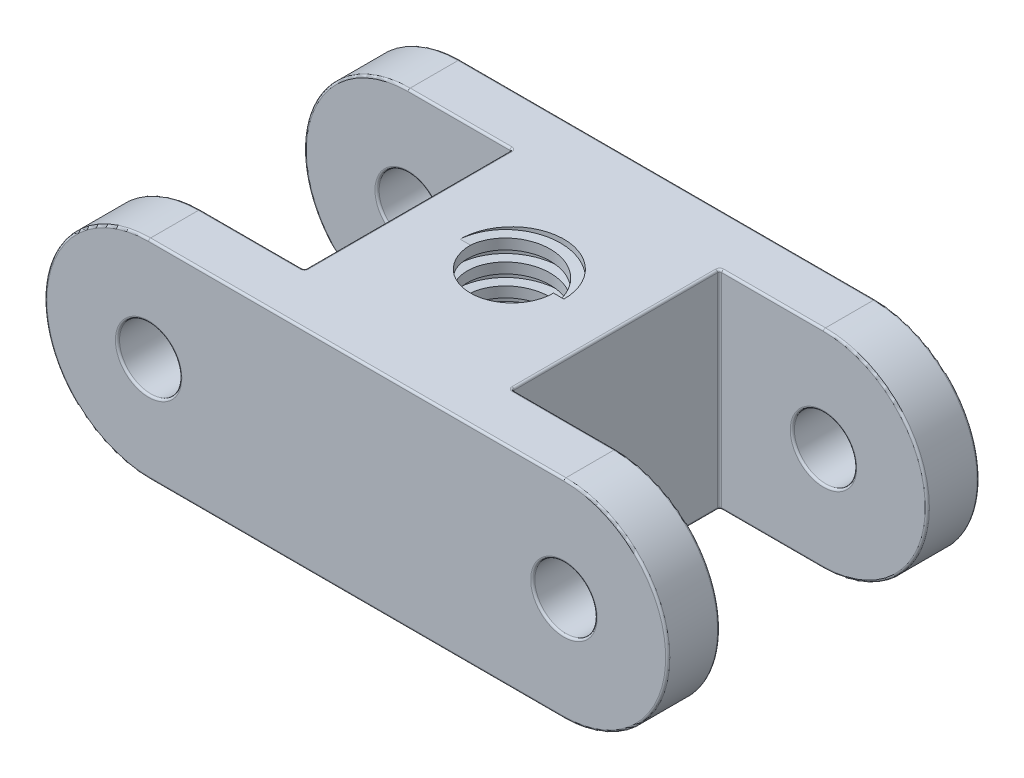
from build123d import *

# Parameters (mm, degrees)
SKETCH1_R               = 3
BOSS_EXTRUDE1_DEPTH     = 15
CUT_EXTRUDE1_DEPTH      = 40.05124838
CUT_EXTRUDE1_DEPTH_BACK = 40.05124838
SKETCH2_R               = 4
SKETCH2_W               = 50
SKETCH2_H               = 20
CUT_SWEEP1_PITCH        = 2
FILLET1_R               = 0.2


with BuildPart() as part:
    # Sketch1 → Boss-Extrude1 (new, symmetric)
    with BuildSketch(Plane.XY):
        with BuildLine():
            Line((-20, 20), (20, 20))
            ThreePointArc((20, 20), (30, 10), (20, 0))
            Line((20, 0), (-20, 0))
            ThreePointArc((-20, 0), (-30, 10), (-20, 20))
        make_face()
        with Locations((-20, 10)):
            Circle(SKETCH1_R, mode=Mode.SUBTRACT)
        with Locations((20, 10)):
            Circle(SKETCH1_R, mode=Mode.SUBTRACT)
    extrude(amount=BOSS_EXTRUDE1_DEPTH, both=True)

    # Sketch2 → Cut-Extrude1 (cut, two sides: drawn at the far end of the back side and taken through both)
    with BuildSketch(Plane(origin=(0, 20, 0), x_dir=(1, 0, 0), z_dir=(0, 1, 0)).offset(-CUT_EXTRUDE1_DEPTH_BACK)):
        with Locations(Location((0, 0, 0), (0, 0, 270))):
            Circle(SKETCH2_R)
        with Locations((-35, 0)):
            Rectangle(SKETCH2_W, SKETCH2_H)
        with Locations((35, 0)):
            Rectangle(SKETCH2_W, SKETCH2_H)
    extrude(amount=CUT_EXTRUDE1_DEPTH + CUT_EXTRUDE1_DEPTH_BACK, mode=Mode.SUBTRACT)

    # Cut-Sweep1: the profile of Sketch5 profile screwed along a right-hand helix of 15 turns, 10 arcs to a turn; built about Z, then put on its axis
    cut_sweep1_z = Axis((0, 0, 0), (0, 0, 1))
    cut_sweep1_corners = [(3.9997, 0, 0), (5, 0, 0), (5, 0, -1), (3.9997, 0, -1)]
    with BuildLine(mode=Mode.PRIVATE) as cut_sweep1_profile:
        Line(cut_sweep1_corners[0], cut_sweep1_corners[1])
        Line(cut_sweep1_corners[1], cut_sweep1_corners[2])
        Line(cut_sweep1_corners[2], cut_sweep1_corners[3])
        Line(cut_sweep1_corners[3], cut_sweep1_corners[0])
    cut_sweep1_cap = Face(cut_sweep1_profile.wire())
    cut_sweep1_turn_angles = [0, 18, 36, 54, 72, 90, 108, 126, 144, 162, 180, 198, 216, 234, 252, 270, 288, 306, 324, 342, 360]
    cut_sweep1_turn_weights = [1, 0.9510565162951535, 1, 0.9510565162951535, 1, 0.9510565162951535, 1, 0.9510565162951535, 1, 0.9510565162951535, 1, 0.9510565162951535, 1, 0.9510565162951535, 1, 0.9510565162951535, 1, 0.9510565162951535, 1, 0.9510565162951535, 1]
    cut_sweep1_turn_rails = [Edge.make_bspline([Vector(p[0], p[1], 0).rotate(cut_sweep1_z, cut_sweep1_turn_angles[k]) / cut_sweep1_turn_weights[k] + Vector(0, 0, p[2] + CUT_SWEEP1_PITCH * cut_sweep1_turn_angles[k] / 360) for k in range(21)], [0, 0, 0, 1, 1, 2, 2, 3, 3, 4, 4, 5, 5, 6, 6, 7, 7, 8, 8, 9, 9, 10, 10, 10], 2, cut_sweep1_turn_weights) for p in cut_sweep1_corners]
    cut_sweep1_turn_sides = [Face.make_surface_from_curves(cut_sweep1_turn_rails[p[0]], cut_sweep1_turn_rails[p[1]]) for p in [(0, 1), (1, 2), (2, 3), (3, 0)]]
    cut_sweep1 = Plane(origin=(0, 0, 0), x_dir=(1, 0, 0), z_dir=(0, 1, 0)) * Solid(Shell([*[p.moved(Location((0, 0, CUT_SWEEP1_PITCH * i))) for i in range(15) for p in cut_sweep1_turn_sides], cut_sweep1_cap, cut_sweep1_cap.rotate(cut_sweep1_z, 5400).moved(Location((0, 0, CUT_SWEEP1_PITCH * 5400 / 360)))]))
    add(cut_sweep1, mode=Mode.SUBTRACT)

    # Fillet1
    fillet1_edges = [part.edges().sort_by_distance(p)[0] for p in [
        (30, 10, 15),
        (17, 10, -15),
        (17, 10, 15),
        (0, 20, 15),
        (-23, 10, -15),
        (-23, 10, 15),
        (-10, 20, 0),
        (-10, 10, -10),
        (-10, 0, 0),
        (-15, 20, 10),
        (-30, 10, 10),
        (-15, 0, 10),
        (-10, 10, 10),
        (-23, 10, 10),
        (-15, 0, -10),
        (-30, 10, -10),
        (-15, 20, -10),
        (-23, 10, -10),
        (-30, 10, 15),
        (10, 20, 0),
        (0, 20, -15),
        (30, 10, -15),
        (10, 10, 10),
        (10, 0, 0),
        (15, 20, -10),
        (30, 10, -10),
        (15, 0, -10),
        (0, 0, -15),
        (10, 10, -10),
        (17, 10, -10),
        (15, 0, 10),
        (30, 10, 10),
        (15, 20, 10),
        (17, 10, 10),
        (-30, 10, -15),
        (0, 0, 15),
    ]]
    fillet(fillet1_edges, radius=FILLET1_R)


solid = part.part
